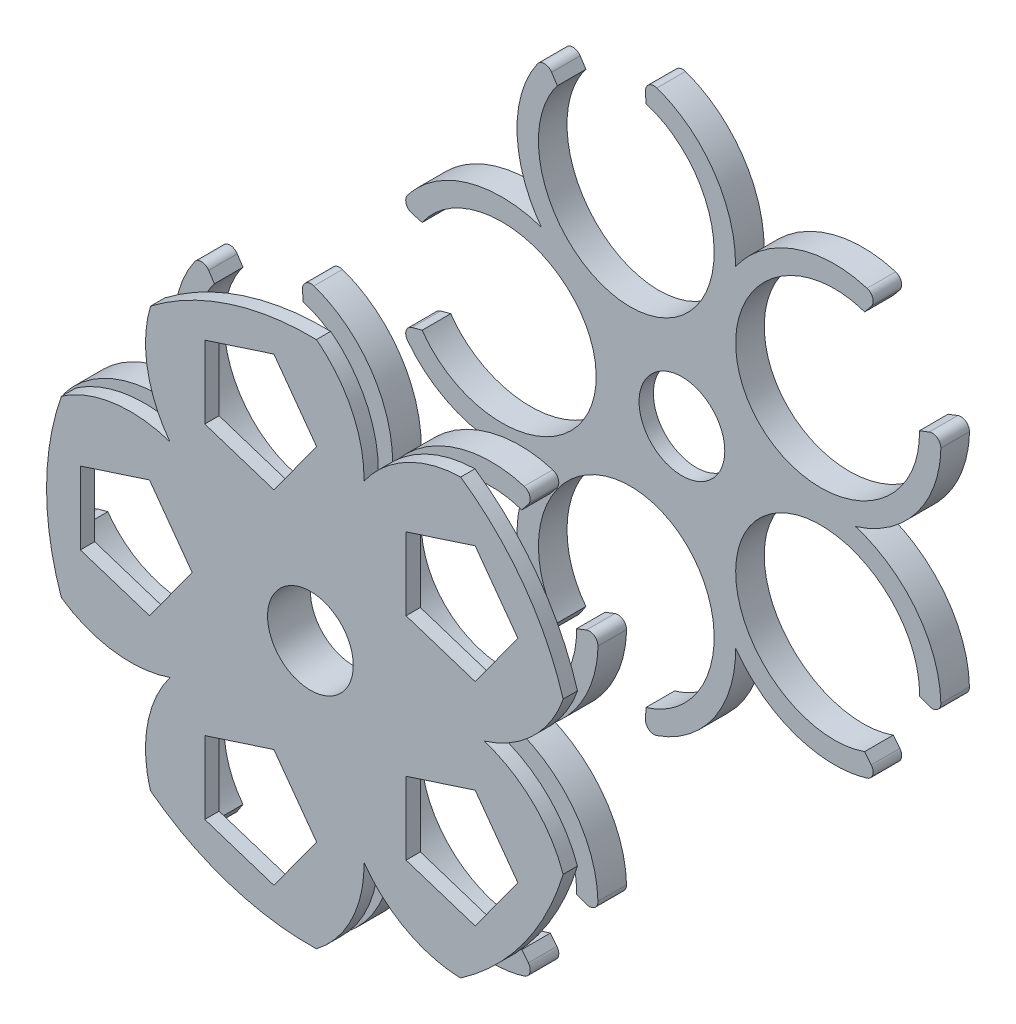
from build123d import *

# Parameters (mm, degrees)
BOSS_EXTRUDE1_DEPTH = 10
CIRPATTERN1_COUNT   = 5
SKETCH4_R           = 15
BOSS_EXTRUDE2_DEPTH = 5
LPATTERN1_COUNT     = 2
LPATTERN1_PITCH     = 120
BOSS_EXTRUDE3_START = 5
SKETCH5_R           = 15
BOSS_EXTRUDE3_DEPTH = 5
BOSS_EXTRUDE4_START = 5
SKETCH6_R           = 15
BOSS_EXTRUDE4_DEPTH = 5


with BuildPart() as part:
    # Sketch1 → Boss-Extrude1 (new body)
    with BuildSketch(Plane.XY):
        with BuildLine():
            Line((-90.882850735, 16.313510687), (-94.428028859, 17.263438303))
            ThreePointArc((-94.428028859, 17.263438303), (-96.488628296, 19.185967093), (-96.045623977, 21.969118933))
            add(Edge.make_bspline(
                [(-96.045623977, -21.969118933), (-22.5, -119.359328544), (-22.5, 0), (-22.5, 119.359328544), (-96.045623977, 21.969118933)],
                knots=[3.758033427, 3.758033427, 3.758033427, 6.283185307, 6.283185307, 8.808337187, 8.808337187, 8.808337187], degree=2, weights=[1, 0.303363369, 1, 0.303363369, 1]))
            ThreePointArc((-96.045623977, -21.969118933), (-96.488628296, -19.185967093), (-94.428028859, -17.263438303))
            Line((-94.428028859, -17.263438303), (-90.882850735, -16.313510687))
            add(Edge.make_bspline(
                [(-90.882850735, -16.313510687), (-30, -105.204250416), (-30, 0), (-30, 105.204250416), (-90.882850735, 16.313510687)],
                knots=[3.705945592, 3.705945592, 3.705945592, 6.283185307, 6.283185307, 8.860425023, 8.860425023, 8.860425023], degree=2, weights=[1, 0.2784467, 1, 0.2784467, 1]))
        make_face()
    extrude(amount=BOSS_EXTRUDE1_DEPTH)


with BuildPart() as cirpattern1_1:
    # CirPattern1: pattern copy
    add(part.part.rotate(Axis((0, 0, 0), (0, 0, 1)), 1 * 360 / CIRPATTERN1_COUNT))


with BuildPart() as cirpattern1_2:
    # CirPattern1: pattern copy
    add(part.part.rotate(Axis((0, 0, 0), (0, 0, 1)), 2 * 360 / CIRPATTERN1_COUNT))


with BuildPart() as cirpattern1_3:
    # CirPattern1: pattern copy
    add(part.part.rotate(Axis((0, 0, 0), (0, 0, 1)), 3 * 360 / CIRPATTERN1_COUNT))


with BuildPart() as cirpattern1_4:
    # CirPattern1: pattern copy
    add(part.part.rotate(Axis((0, 0, 0), (0, 0, 1)), 4 * 360 / CIRPATTERN1_COUNT))


with BuildPart() as part_1:
    add(part.part)

    add(cirpattern1_1.part)  # Boss-Extrude2 merges CirPattern1_1

    add(cirpattern1_2.part)  # Boss-Extrude2 merges CirPattern1_2

    add(cirpattern1_3.part)  # Boss-Extrude2 merges CirPattern1_3

    add(cirpattern1_4.part)  # Boss-Extrude2 merges CirPattern1_4
    # Sketch4 → Boss-Extrude2 (add)
    with BuildSketch(Plane.XY.offset(10)):
        with BuildLine():
            add(Edge.make_bspline(
                [(11.314250367, -34.821682092), (-4.282878688, -13.18134523), (-29.621092019, -21.520983078)],
                knots=[5.681125071, 5.681125071, 5.681125071, 6.885245543, 6.885245543, 6.885245543], degree=2, weights=[1, 0.824170567, 1]))
            add(Edge.make_bspline(
                [(36.613683304, 0), (11.212721975, -8.146519369), (11.314250367, -34.821682092)],
                knots=[5.681125071, 5.681125071, 5.681125071, 6.885245543, 6.885245543, 6.885245543], degree=2, weights=[1, 0.824170567, 1]))
            add(Edge.make_bspline(
                [(11.314250367, 34.821682092), (11.212721975, 8.146519369), (36.613683304, 0)],
                knots=[5.681125071, 5.681125071, 5.681125071, 6.885245543, 6.885245543, 6.885245543], degree=2, weights=[1, 0.824170567, 1]))
            add(Edge.make_bspline(
                [(-29.621092019, 21.520983078), (-4.282878688, 13.18134523), (11.314250367, 34.821682092)],
                knots=[5.681125071, 5.681125071, 5.681125071, 6.885245543, 6.885245543, 6.885245543], degree=2, weights=[1, 0.824170567, 1]))
            add(Edge.make_bspline(
                [(-29.621092019, -21.520983078), (-13.859686574, 0), (-29.621092019, 21.520983078)],
                knots=[2.539532418, 2.539532418, 2.539532418, 3.74365289, 3.74365289, 3.74365289], degree=2, weights=[1, 0.824170567, 1]))
        make_face()
        Circle(SKETCH4_R, mode=Mode.SUBTRACT)
    extrude(amount=-BOSS_EXTRUDE2_DEPTH)


with BuildPart() as lpattern1_1:
    # LPattern1: pattern copy
    add(part_1.part.moved(Location(Vector(0, 0, 1) * (1 * LPATTERN1_PITCH))))

    # Sketch5 → Boss-Extrude3 (add)
    with BuildSketch(Plane.XY.offset(130).offset(BOSS_EXTRUDE3_START)):
        Polygon((9.549150281, 29.389262615), (-25, 18.1635632), (-25, -18.1635632), (9.549150281, -29.389262615), (30.901699437, 0), align=None)
        Circle(SKETCH5_R, mode=Mode.SUBTRACT)
    extrude(amount=-BOSS_EXTRUDE3_DEPTH)

    # Sketch6 → Boss-Extrude4 (add)
    with BuildSketch(Plane.XY.offset(135).offset(BOSS_EXTRUDE4_START)):
        with BuildLine():
            ThreePointArc((-55.942472773, -73.459260333), (-28.533202922, -87.816168897), (2.080141313, -92.311950477))
            add(Edge.make_bspline(
                [(2.080141313, -92.311950477), (19.096140546, -79.431875664), (18.773008887, -57.777380395)],
                knots=[0.931883543, 0.931883543, 0.931883543, 1.919857155, 1.919857155, 1.919857155], degree=2, weights=[1, 0.880449557, 1]))
            add(Edge.make_bspline(
                [(18.773008887, -57.777380395), (31.239782848, -75.486167096), (52.576733428, -75.904613106)],
                knots=[1.221735499, 1.221735499, 1.221735499, 2.209709111, 2.209709111, 2.209709111], degree=2, weights=[1, 0.880449557, 1]))
            ThreePointArc((52.576733428, -75.904613106), (74.700895058, -54.27337714), (88.436681049, -26.547629531))
            add(Edge.make_bspline(
                [(88.436681049, -26.547629531), (81.445234908, -6.384290573), (60.750732901, 0)],
                knots=[4.073476196, 4.073476196, 4.073476196, 5.061449808, 5.061449808, 5.061449808], degree=2, weights=[1, 0.880449557, 1]))
            add(Edge.make_bspline(
                [(60.750732901, 0), (81.445234908, 6.384290573), (88.436681049, 26.547629531)],
                knots=[1.221735499, 1.221735499, 1.221735499, 2.209709111, 2.209709111, 2.209709111], degree=2, weights=[1, 0.880449557, 1]))
            ThreePointArc((88.436681049, 26.547629531), (74.700895058, 54.27337714), (52.576733428, 75.904613106))
            add(Edge.make_bspline(
                [(52.576733428, 75.904613106), (31.239782848, 75.486167096), (18.773008887, 57.777380395)],
                knots=[4.073476196, 4.073476196, 4.073476196, 5.061449808, 5.061449808, 5.061449808], degree=2, weights=[1, 0.880449557, 1]))
            add(Edge.make_bspline(
                [(18.773008887, 57.777380395), (19.096140546, 79.431875664), (2.080141313, 92.311950477)],
                knots=[1.221735499, 1.221735499, 1.221735499, 2.209709111, 2.209709111, 2.209709111], degree=2, weights=[1, 0.880449557, 1]))
            ThreePointArc((2.080141313, 92.311950477), (-28.533202922, 87.816168897), (-55.942472773, 73.459260333))
            add(Edge.make_bspline(
                [(-55.942472773, 73.459260333), (-62.137987306, 53.037307518), (-49.148375337, 35.708384865)],
                knots=[4.073476196, 4.073476196, 4.073476196, 5.061449808, 5.061449808, 5.061449808], degree=2, weights=[1, 0.880449557, 1]))
            add(Edge.make_bspline(
                [(-49.148375337, 35.708384865), (-69.643170996, 42.707308378), (-87.151083016, 30.504293432)],
                knots=[4.363328152, 4.363328152, 4.363328152, 5.351301765, 5.351301765, 5.351301765], degree=2, weights=[1, 0.880449557, 1]))
            ThreePointArc((-87.151083016, 30.504293432), (-92.335384272, 0), (-87.151083016, -30.504293432))
            add(Edge.make_bspline(
                [(-87.151083016, -30.504293432), (-69.643170996, -42.707308378), (-49.148375337, -35.708384865)],
                knots=[0.931883543, 0.931883543, 0.931883543, 1.919857155, 1.919857155, 1.919857155], degree=2, weights=[1, 0.880449557, 1]))
            add(Edge.make_bspline(
                [(-49.148375337, -35.708384865), (-62.137987306, -53.037307518), (-55.942472773, -73.459260333)],
                knots=[4.363328152, 4.363328152, 4.363328152, 5.351301765, 5.351301765, 5.351301765], degree=2, weights=[1, 0.880449557, 1]))
        make_face()
        Circle(SKETCH6_R, mode=Mode.SUBTRACT)
        Polygon((2.163118961, 59.916560527), (-12.783665449, 80.489044357), (-36.968070646, 72.631054767), (-36.968070646, 47.202066287), (-12.783665449, 39.344076696), align=None, mode=Mode.SUBTRACT)
        Polygon((-41.368810394, 0), (-56.315594803, 20.57248383), (-80.5, 12.71449424), (-80.5, -12.71449424), (-56.315594803, -20.57248383), align=None, mode=Mode.SUBTRACT)
        Polygon((57.652475842, 16.457987064), (72.599260252, 37.030470894), (57.652475842, 57.602954725), (33.468070646, 49.744965135), (33.468070646, 24.315976654), align=None, mode=Mode.SUBTRACT)
        Polygon((33.468070646, -49.744965135), (57.652475842, -57.602954725), (72.599260252, -37.030470894), (57.652475842, -16.457987064), (33.468070646, -24.315976654), align=None, mode=Mode.SUBTRACT)
        Polygon((-36.968070646, -47.202066287), (-36.968070646, -72.631054767), (-12.783665449, -80.489044357), (2.163118961, -59.916560527), (-12.783665449, -39.344076696), align=None, mode=Mode.SUBTRACT)
    extrude(amount=-BOSS_EXTRUDE4_DEPTH)


solid = Compound([part_1.part, lpattern1_1.part])
